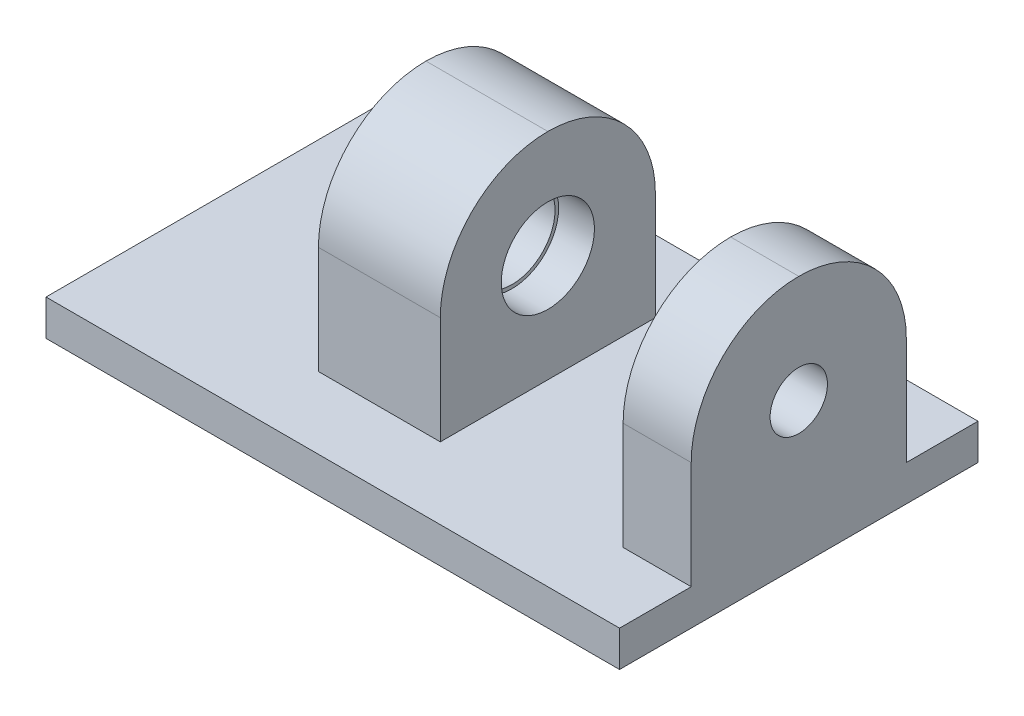
from build123d import *

# Parameters (mm, degrees)
SKETCH1_W           = 80
SKETCH1_H           = 50
BOSS_EXTRUDE1_DEPTH = 5
SKETCH2_W           = 17
SKETCH2_H           = 30
SKETCH2_W_2         = 9.5
BOSS_EXTRUDE2_DEPTH = 30
FILLET1_R           = 15
SKETCH3_R           = 4
CUT_EXTRUDE1_DEPTH  = 30
SKETCH4_R           = 6.5
CUT_EXTRUDE2_DEPTH  = 5
SKETCH5_R           = 6
CUT_EXTRUDE3_DEPTH  = 14


with BuildPart() as part:
    # Sketch1 → Boss-Extrude1 (new body)
    with BuildSketch(Plane(origin=(0, 0, 0), x_dir=(1, 0, 0), z_dir=(0, 1, 0))):
        Rectangle(SKETCH1_W, SKETCH1_H)
    extrude(amount=BOSS_EXTRUDE1_DEPTH)

    # Sketch2 → Boss-Extrude2 (add)
    with BuildSketch(Plane(origin=(0, 5, 0), x_dir=(1, 0, 0), z_dir=(0, 1, 0))):
        with Locations((-3.5, 0)):
            Rectangle(SKETCH2_W, SKETCH2_H)
        with Locations((35.25, 0)):
            Rectangle(SKETCH2_W_2, SKETCH2_H)
    extrude(amount=BOSS_EXTRUDE2_DEPTH)

    # Fillet1
    fillet1_edges = [part.edges().sort_by_distance(p)[0] for p in [
        (-3.5, 35, -15),
        (-3.5, 35, 15),
        (35.25, 35, -15),
        (35.25, 35, 15),
    ]]
    fillet(fillet1_edges, radius=FILLET1_R - 0.0001)  # a hair under: the kernel refuses the full size

    # Sketch3 → Cut-Extrude1 (cut)
    with BuildSketch(Plane.ZY.offset(-30.5)):
        with Locations((0, 20)):
            Circle(SKETCH3_R)
    extrude(amount=-CUT_EXTRUDE1_DEPTH, mode=Mode.SUBTRACT)

    # Sketch4 → Cut-Extrude2 (cut)
    with BuildSketch(Plane(origin=(5, 0, 0), x_dir=(0, 0, -1), z_dir=(1, 0, 0))):
        with Locations((0, 20)):
            Circle(SKETCH4_R)
    extrude(amount=-CUT_EXTRUDE2_DEPTH, mode=Mode.SUBTRACT)

    # Sketch5 → Cut-Extrude3 (cut)
    with BuildSketch(Plane.ZY.offset(12)):
        with Locations((0, 20)):
            Circle(SKETCH5_R)
    extrude(amount=-CUT_EXTRUDE3_DEPTH, mode=Mode.SUBTRACT)


solid = part.part
